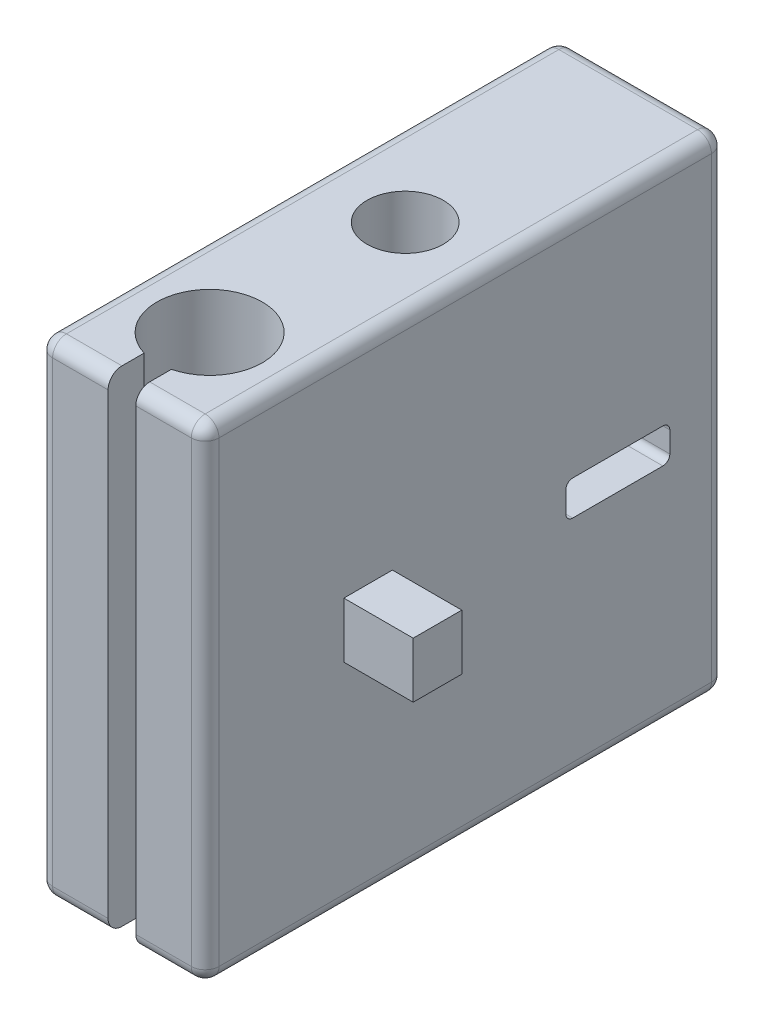
from build123d import *

# Parameters (mm, degrees)
RESSALTO_EXTRUS_O1_DEPTH      = 12
RESSALTO_EXTRUS_O1_DEPTH_BACK = 12
ESBO_O1_W                     = 75
ESBO_O1_H                     = 70
ESBO_O3_R                     = 5.5
CORTE_EXTRUS_O1_DEPTH         = 525.799189678
ESBO_O4_R                     = 4.1
CORTE_EXTRUS_O2_DEPTH         = 20
FILETE1_R                     = 2
CORTE_EXTRUS_O3_DEPTH         = 29
CORTE_EXTRUS_O4_DEPTH         = 28
RESSALTO_EXTRUS_O2_DEPTH      = 10
RESSALTO_EXTRUS_O2_DEPTH_BACK = 34
ESBO_O7_W                     = 7
ESBO_O7_H                     = 8


with BuildPart() as part:
    # Esboço1 → Ressalto-extrusão1 (new, two sides: drawn at the far end of the back side and taken through both)
    with BuildSketch(Plane(origin=(-220, 0, 0), x_dir=(0, 0, -1), z_dir=(1, 0, 0)).offset(-RESSALTO_EXTRUS_O1_DEPTH_BACK)):
        with Locations((-427.999935002, 213.253952806)):
            Rectangle(ESBO_O1_W, ESBO_O1_H)
    extrude(amount=RESSALTO_EXTRUS_O1_DEPTH + RESSALTO_EXTRUS_O1_DEPTH_BACK)

    # Esboço3 → Corte-extrusão1 (cut, through all)
    with BuildSketch(Plane(origin=(0, 248.253952806, 0), x_dir=(1, 0, 0), z_dir=(0, 1, 0))):
        with Locations((-219.508549322, -425.149935105)):
            Circle(ESBO_O3_R)
        with BuildLine():
            Line((-220, -465.499935002), (-218, -465.499935002))
            Line((-218, -465.499935002), (-218, -460.369179456))
            ThreePointArc((-218, -460.369179456), (-219.711945476, -445.401349285), (-222, -460.292000844))
            Line((-222, -460.292000844), (-222, -465.499935002))
            Line((-222, -465.499935002), (-220, -465.499935002))
        make_face()
    extrude(amount=-CORTE_EXTRUS_O1_DEPTH, mode=Mode.SUBTRACT)

    # Esboço4 → Corte-extrusão2 (cut)
    with BuildSketch(Plane(origin=(0, 0, 390.499935002), x_dir=(-1, 0, 0), z_dir=(0, 0, -1))):
        with Locations((219.858557552, 238.253952806)):
            Circle(ESBO_O4_R)
        with Locations((219.858557552, 188.253952806)):
            Circle(ESBO_O4_R)
    extrude(amount=-CORTE_EXTRUS_O2_DEPTH, mode=Mode.SUBTRACT)

    # Filete1
    filete1_edges = [part.edges().sort_by_distance(p)[0] for p in [
        (-227, 178.253952806, 465.499935002),
        (-213, 178.253952806, 465.499935002),
        (-213, 248.253952806, 465.499935002),
        (-227, 248.253952806, 465.499935002),
        (-208, 178.253952806, 427.999935002),
        (-208, 248.253952806, 427.999935002),
        (-208, 213.253952806, 465.499935002),
        (-232, 178.253952806, 427.999935002),
        (-232, 213.253952806, 465.499935002),
        (-232, 248.253952806, 427.999935002),
        (-220, 248.253952806, 390.499935002),
        (-220, 178.253952806, 390.499935002),
        (-208, 213.253952806, 390.499935002),
        (-232, 213.253952806, 390.499935002),
    ]]
    fillet(filete1_edges, radius=FILETE1_R)

    # Esboço5 → Corte-extrusão3 (cut)
    with BuildSketch(Plane(origin=(0, 0, 390.499935002), x_dir=(-1, 0, 0), z_dir=(0, 0, -1))):
        Polygon((214.029916019, 195.25845757), (226.029911989, 195.248623364), (226.059414609, 231.248611275), (214.059418639, 231.258445482), align=None)
    extrude(amount=-CORTE_EXTRUS_O3_DEPTH, mode=Mode.SUBTRACT)

    # Esboço6 → Corte-extrusão4 (cut)
    with BuildSketch(Plane.ZY.offset(232)):
        with BuildLine():
            Line((399.499935002, 215.753952806), (412.499935002, 215.753952806))
            ThreePointArc((412.499935002, 215.753952806), (413.207041783, 215.461059587), (413.499935002, 214.753952806))
            Line((413.499935002, 214.753952806), (413.499935002, 211.753952806))
            ThreePointArc((413.499935002, 211.753952806), (413.207041783, 211.046846025), (412.499935002, 210.753952806))
            Line((412.499935002, 210.753952806), (399.499935002, 210.753952806))
            ThreePointArc((399.499935002, 210.753952806), (398.792828221, 211.046846025), (398.499935002, 211.753952806))
            Line((398.499935002, 211.753952806), (398.499935002, 214.753952806))
            ThreePointArc((398.499935002, 214.753952806), (398.792828221, 215.461059587), (399.499935002, 215.753952806))
        make_face()
    extrude(amount=-CORTE_EXTRUS_O4_DEPTH, mode=Mode.SUBTRACT)

    # Esboço7 → Ressalto-extrusão2 (add, two sides: drawn at the far end of the back side and taken through both)
    with BuildSketch(Plane(origin=(-208, 0, 0), x_dir=(0, 0, -1), z_dir=(1, 0, 0)).offset(-RESSALTO_EXTRUS_O2_DEPTH_BACK)):
        with Locations((-441.999935002, 213.253952806)):
            Rectangle(ESBO_O7_W, ESBO_O7_H)
    extrude(amount=RESSALTO_EXTRUS_O2_DEPTH + RESSALTO_EXTRUS_O2_DEPTH_BACK)


solid = part.part
